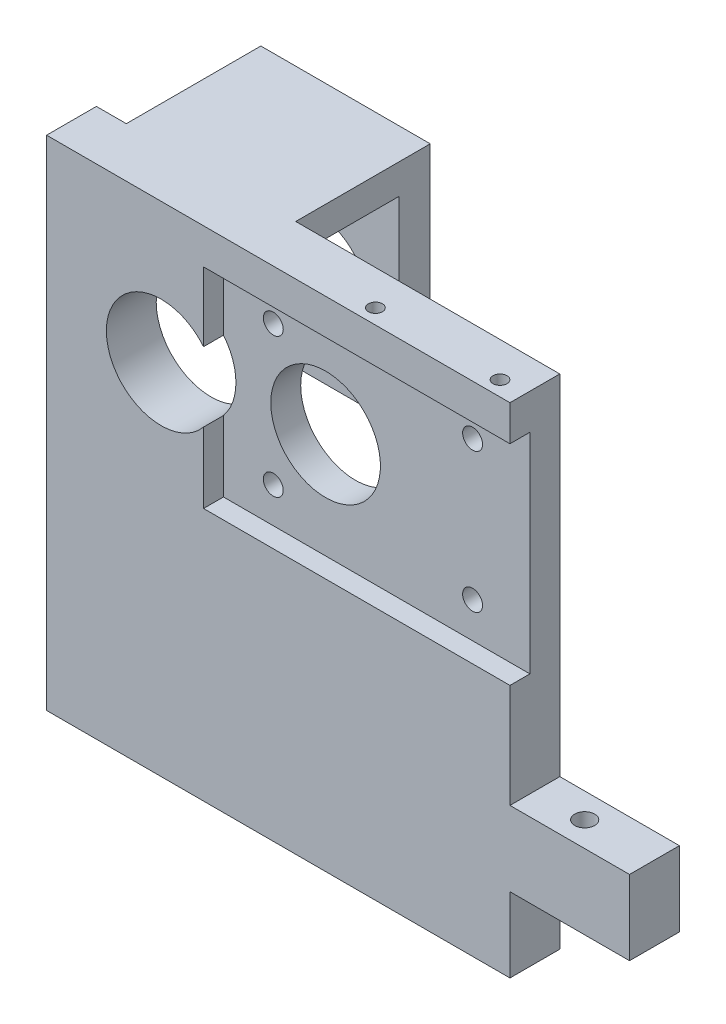
from build123d import *

# Parameters (mm, degrees)
SKETCH1_W           = 93
SKETCH1_H           = 100
BOSS_EXTRUDE2_DEPTH = 10
SKETCH4_W           = 10.01
SKETCH4_H           = 15
BOSS_EXTRUDE4_DEPTH = 24
SKETCH5_R           = 2
CUT_EXTRUDE1_DEPTH  = 50
SKETCH7_R           = 11
CUT_EXTRUDE3_DEPTH  = 50
SKETCH14_W          = 61.5
SKETCH14_H          = 42
CUT_EXTRUDE8_DEPTH  = 4
SKETCH19_R          = 11
CUT_EXTRUDE11_DEPTH = 15
SKETCH20_R          = 2
CUT_EXTRUDE12_DEPTH = 10
SKETCH8_R           = 1.4
CUT_EXTRUDE4_DEPTH  = 5.5
SKETCH21_W          = 40
SKETCH21_H          = 6
BOSS_EXTRUDE5_DEPTH = 27
SKETCH22_W          = 40
SKETCH22_H          = 6.3
BOSS_EXTRUDE7_DEPTH = 40
CUT_EXTRUDE14_START = 40
SKETCH19_3_R        = 11
CUT_EXTRUDE14_DEPTH = 40
SKETCH24_W          = 6
SKETCH24_H          = 46
CUT_EXTRUDE15_DEPTH = 27


with BuildPart() as part:
    # Sketch1 → Boss-Extrude2 (new body)
    with BuildSketch(Plane.XY):
        with Locations((-29.68705036, 14.928057554)):
            Rectangle(SKETCH1_W, SKETCH1_H)
    extrude(amount=BOSS_EXTRUDE2_DEPTH)

    # Sketch4 → Boss-Extrude4 (add)
    with BuildSketch(Plane(origin=(16.81294964, 0, 0), x_dir=(0, 0, -1), z_dir=(1, 0, 0))):
        with Locations((-4.995, -12.571942446)):
            Rectangle(SKETCH4_W, SKETCH4_H)
    extrude(amount=BOSS_EXTRUDE4_DEPTH)

    # Sketch5 → Cut-Extrude1 (cut)
    with BuildSketch(Plane(origin=(0, -5.071942446, 0), x_dir=(1, 0, 0), z_dir=(0, 1, 0))):
        with Locations((26.81294964, -5)):
            Circle(SKETCH5_R)
    extrude(amount=-CUT_EXTRUDE1_DEPTH, mode=Mode.SUBTRACT)

    # Sketch7 → Cut-Extrude3 (cut)
    with BuildSketch(Plane(origin=(0, 0, 0), x_dir=(-1, 0, 0), z_dir=(0, 0, -1))):
        with Locations((24.18705036, 36.928057554)):
            Circle(SKETCH7_R)
    extrude(amount=-CUT_EXTRUDE3_DEPTH, mode=Mode.SUBTRACT)

    # Sketch14 → Cut-Extrude8 (cut)
    with BuildSketch(Plane.XY.offset(10)):
        with Locations((-13.93705036, 36.789132279)):
            Rectangle(SKETCH14_W, SKETCH14_H)
    extrude(amount=-CUT_EXTRUDE8_DEPTH, mode=Mode.SUBTRACT)

    # Sketch19 → Cut-Extrude11 (cut)
    with BuildSketch(Plane(origin=(0, 0, 0), x_dir=(-1, 0, 0), z_dir=(0, 0, -1))):
        with Locations((53.18705036, 36.928057554)):
            Circle(SKETCH19_R)
    extrude(amount=-CUT_EXTRUDE11_DEPTH, mode=Mode.SUBTRACT)

    # Sketch20 → Cut-Extrude12 (cut)
    with BuildSketch(Plane.XY.offset(6)):
        with Locations((-34.68705036, 50.928057554)):
            Circle(SKETCH20_R)
        with Locations((5.31294964, 50.928057554)):
            Circle(SKETCH20_R)
        with Locations((-34.68705036, 22.928057554)):
            Circle(SKETCH20_R)
        with Locations((5.31294964, 22.928057554)):
            Circle(SKETCH20_R)
    extrude(amount=-CUT_EXTRUDE12_DEPTH, mode=Mode.SUBTRACT)

    # Sketch8 → Cut-Extrude4 (cut)
    with BuildSketch(Plane(origin=(0, 64.928057554, 0), x_dir=(1, 0, 0), z_dir=(0, 1, 0))):
        with Locations((11.81294964, -7)):
            Circle(SKETCH8_R)
        with Locations((-13.18705036, -7)):
            Circle(SKETCH8_R)
    extrude(amount=-CUT_EXTRUDE4_DEPTH, mode=Mode.SUBTRACT)

    # Sketch21 → Boss-Extrude5 (add)
    with BuildSketch(Plane(origin=(0, 0, 0), x_dir=(-1, 0, 0), z_dir=(0, 0, -1))):
        with Locations((56.18705036, 61.928057554)):
            Rectangle(SKETCH21_W, SKETCH21_H)
    extrude(amount=BOSS_EXTRUDE5_DEPTH)

    # Sketch22 → Boss-Extrude7 (add)
    with BuildSketch(Plane.XZ.offset(-58.928057554)):
        with Locations((-56.18705036, -23.85)):
            Rectangle(SKETCH22_W, SKETCH22_H)
    extrude(amount=BOSS_EXTRUDE7_DEPTH)

    # Sketch19<3> → Cut-Extrude14 (cut)
    with BuildSketch(Plane(origin=(0, 0, 0), x_dir=(-1, 0, 0), z_dir=(0, 0, -1)).offset(CUT_EXTRUDE14_START)):
        with Locations((53.18705036, 36.928057554)):
            Circle(SKETCH19_3_R)
    extrude(amount=-CUT_EXTRUDE14_DEPTH, mode=Mode.SUBTRACT)

    # Sketch24 → Cut-Extrude15 (cut)
    with BuildSketch(Plane(origin=(0, 0, -27), x_dir=(-1, 0, 0), z_dir=(0, 0, -1))):
        with Locations((73.18705036, 41.928057554)):
            Rectangle(SKETCH24_W, SKETCH24_H)
    extrude(amount=-CUT_EXTRUDE15_DEPTH, mode=Mode.SUBTRACT)


solid = part.part
